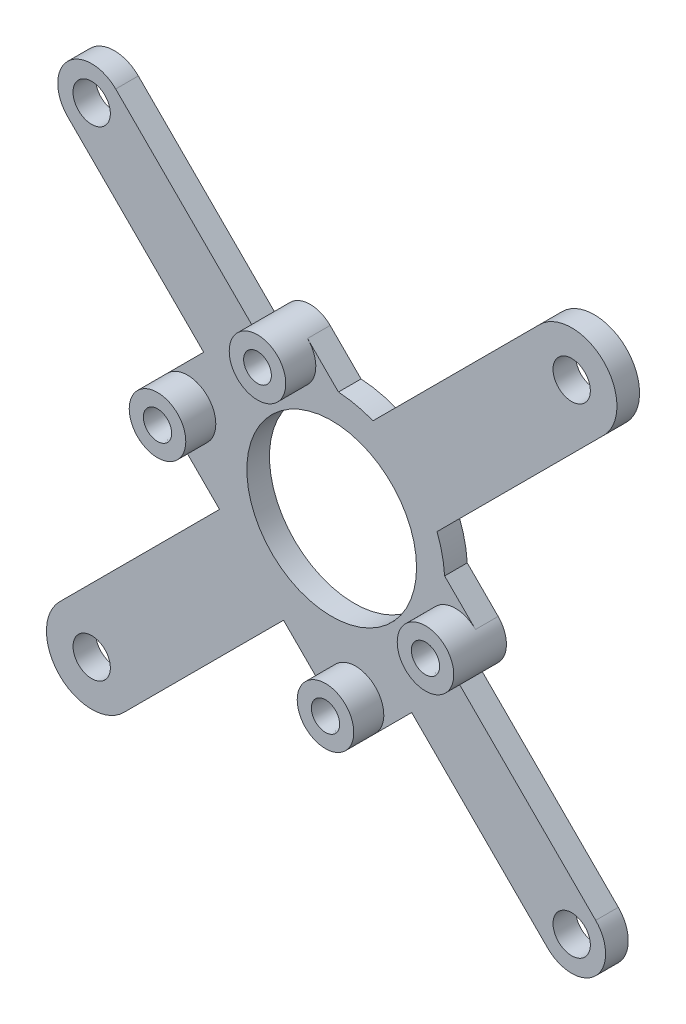
from build123d import *

# Parameters (mm, degrees)
SKETCH1_R           = 1.65
BOSS_EXTRUDE1_DEPTH = 2
SKETCH2_R           = 1.25
BOSS_EXTRUDE2_DEPTH = 2
SKETCH3_R           = 7.5
CUT_EXTRUDE1_DEPTH  = 2
BOSS_EXTRUDE3_START = 2.65408
SKETCH4_R           = 2.5
SKETCH4_R_2         = 1.25
BOSS_EXTRUDE3_DEPTH = 2.65408
SKETCH5_R           = 1.797788616
SKETCH5_R_2         = 1.10000034
SKETCH5_R_3         = 2.012466026
SKETCH5_R_4         = 1.729091626
SKETCH5_R_5         = 1.81324602
SKETCH5_R_6         = 1.075
BOSS_EXTRUDE4_DEPTH = 4.65408
CHAMFER1_SIZE       = 1.714507845
CHAMFER1_SIZE_2     = 0.15


with BuildPart() as part:
    # Sketch1 → Boss-Extrude1 (new body)
    with BuildSketch(Plane.XY):
        with BuildLine():
            Line((24.04163056, 18.384776311), (9.309167823, 3.652313574))
            ThreePointArc((9.309167823, 3.652313574), (9.985739131, -0.533867035), (8.866689125, -4.624048438))
            Line((8.866689125, -4.624048438), (23.334523779, -19.091883092))
            ThreePointArc((23.334523779, -19.091883092), (23.334523779, -23.334523779), (19.091883092, -23.334523779))
            Line((19.091883092, -23.334523779), (4.624048438, -8.866689125))
            ThreePointArc((4.624048438, -8.866689125), (0.533867035, -9.985739131), (-3.652313574, -9.309167823))
            Line((-3.652313574, -9.309167823), (-18.384776311, -24.04163056))
            ThreePointArc((-18.384776311, -24.04163056), (-24.04163056, -24.04163056), (-24.04163056, -18.384776311))
            Line((-24.04163056, -18.384776311), (-9.309167823, -3.652313574))
            ThreePointArc((-9.309167823, -3.652313574), (-9.985739131, 0.533867035), (-8.866689125, 4.624048438))
            Line((-8.866689125, 4.624048438), (-23.334523779, 19.091883092))
            ThreePointArc((-23.334523779, 19.091883092), (-23.334523779, 23.334523779), (-19.091883092, 23.334523779))
            Line((-19.091883092, 23.334523779), (-4.624048438, 8.866689125))
            ThreePointArc((-4.624048438, 8.866689125), (-0.533867035, 9.985739131), (3.652313574, 9.309167823))
            Line((3.652313574, 9.309167823), (18.384776311, 24.04163056))
            ThreePointArc((18.384776311, 24.04163056), (24.04163056, 24.04163056), (24.04163056, 18.384776311))
        make_face()
        with Locations((21.213203436, -21.213203436)):
            Circle(SKETCH1_R, mode=Mode.SUBTRACT)
        with Locations((21.213203436, 21.213203436)):
            Circle(SKETCH1_R, mode=Mode.SUBTRACT)
        with Locations((-21.213203436, 21.213203436)):
            Circle(SKETCH1_R, mode=Mode.SUBTRACT)
        with Locations((-21.213203436, -21.213203436)):
            Circle(SKETCH1_R, mode=Mode.SUBTRACT)
    extrude(amount=BOSS_EXTRUDE1_DEPTH)

    # Sketch2 → Boss-Extrude2 (add)
    with BuildSketch(Plane.XY.offset(2)):
        with BuildLine():
            Line((-2.135460216, 12.713781538), (12.713781227, -2.135459905))
            ThreePointArc((12.713781227, -2.135459905), (13.446014274, -3.903226858), (12.713781227, -5.670993811))
            Line((12.713781227, -5.670993811), (3.874947975, -14.509827063))
            ThreePointArc((3.874947975, -14.509827063), (2.107181022, -15.24206011), (0.339414069, -14.509827063))
            Line((0.339414069, -14.509827063), (-14.509827374, 0.33941438))
            ThreePointArc((-14.509827374, 0.33941438), (-15.242060421, 2.107181333), (-14.509827374, 3.874948286))
            Line((-14.509827374, 3.874948286), (-5.670994122, 12.713781538))
            ThreePointArc((-5.670994122, 12.713781538), (-3.903227169, 13.446014585), (-2.135460216, 12.713781538))
        make_face()
        with Locations((-3.903227169, 10.946014585)):
            Circle(SKETCH2_R, mode=Mode.SUBTRACT)
        with Locations((10.946014274, -3.903226858)):
            Circle(SKETCH2_R, mode=Mode.SUBTRACT)
        with Locations((2.107181022, -12.74206011)):
            Circle(SKETCH2_R, mode=Mode.SUBTRACT)
        with Locations((-12.742060421, 2.107181333)):
            Circle(SKETCH2_R, mode=Mode.SUBTRACT)
    extrude(amount=-BOSS_EXTRUDE2_DEPTH)

    # Sketch3 → Cut-Extrude1 (cut)
    with BuildSketch(Plane.XY.offset(2)):
        Circle(SKETCH3_R)
    extrude(amount=-CUT_EXTRUDE1_DEPTH, mode=Mode.SUBTRACT)

    # Sketch4 → Boss-Extrude3 (add)
    # profile 1 of 4: a face of its own
    with BuildSketch(Plane.XY.offset(2).offset(BOSS_EXTRUDE3_START)):
        with Locations(Location((-3.903227169, 10.946014585, 0), (0, 0, 45))):
            Circle(SKETCH4_R)
        with Locations((-3.903227169, 10.946014585)):
            Circle(SKETCH4_R_2, mode=Mode.SUBTRACT)
    # profile 2 of 4: a face of its own
    with BuildSketch(Plane.XY.offset(2).offset(BOSS_EXTRUDE3_START)):
        with Locations(Location((-12.742060421, 2.107181333, 0), (0, 0, 135))):
            Circle(SKETCH4_R)
        with Locations((-12.742060421, 2.107181333)):
            Circle(SKETCH4_R_2, mode=Mode.SUBTRACT)
    # profile 3 of 4: a face of its own
    with BuildSketch(Plane.XY.offset(2).offset(BOSS_EXTRUDE3_START)):
        with Locations(Location((10.946014274, -3.903226858, 0), (0, 0, 45))):
            Circle(SKETCH4_R)
        with Locations((10.946014274, -3.903226858)):
            Circle(SKETCH4_R_2, mode=Mode.SUBTRACT)
    # profile 4 of 4: a face of its own
    with BuildSketch(Plane.XY.offset(2).offset(BOSS_EXTRUDE3_START)):
        with Locations(Location((2.107181022, -12.74206011, 0), (0, 0, 315))):
            Circle(SKETCH4_R)
        with Locations((2.107181022, -12.74206011)):
            Circle(SKETCH4_R_2, mode=Mode.SUBTRACT)
    extrude(amount=-BOSS_EXTRUDE3_DEPTH)

    # Sketch5 → Boss-Extrude4 (add)
    # profile 1 of 4: a face of its own
    with BuildSketch(Plane.XY.offset(4.65408)):
        with Locations((10.946014274, -3.903226858)):
            Circle(SKETCH5_R)
        with Locations((10.946014274, -3.903226858)):
            Circle(SKETCH5_R_2, mode=Mode.SUBTRACT)
    # profile 2 of 4: a face of its own
    with BuildSketch(Plane.XY.offset(4.65408)):
        with Locations((2.107181022, -12.74206011)):
            Circle(SKETCH5_R_3)
        with Locations((2.107181022, -12.74206011)):
            Circle(SKETCH5_R_2, mode=Mode.SUBTRACT)
    # profile 3 of 4: a face of its own
    with BuildSketch(Plane.XY.offset(4.65408)):
        with Locations((-12.742060421, 2.107181333)):
            Circle(SKETCH5_R_4)
        with Locations((-12.742060421, 2.107181333)):
            Circle(SKETCH5_R_2, mode=Mode.SUBTRACT)
    # profile 4 of 4: a face of its own
    with BuildSketch(Plane.XY.offset(4.65408)):
        with Locations((-3.903227169, 10.946014585)):
            Circle(SKETCH5_R_5)
        with Locations((-3.903227169, 10.946014585)):
            Circle(SKETCH5_R_6, mode=Mode.SUBTRACT)
    extrude(amount=-BOSS_EXTRUDE4_DEPTH)

    # Chamfer1
    # the kernel refuses this chamfer: 1.714507845, 0.15 mm, written as the material it takes off along each edge
    with BuildSketch(Plane(origin=(10.946014274, -3.903226858, 4.65408), x_dir=(1, 0, 0), z_dir=(0, -1, 0))) as chamfer1_piece_1:
        Polygon((1.10000034, -CHAMFER1_SIZE), (1.10000034 + CHAMFER1_SIZE_2, 0), (1.10000034, 0), align=None)
    revolve(axis=Axis((10.946014274, -3.903226858, 4.65408), (0, 0, 1)), mode=Mode.SUBTRACT)
    with BuildSketch(Plane(origin=(2.107181022, -12.74206011, 4.65408), x_dir=(1, 0, 0), z_dir=(0, -1, 0))) as chamfer1_piece_2:
        Polygon((1.10000034, -CHAMFER1_SIZE), (1.10000034 + CHAMFER1_SIZE_2, 0), (1.10000034, 0), align=None)
    revolve(axis=Axis((2.107181022, -12.74206011, 4.65408), (0, 0, 1)), mode=Mode.SUBTRACT)
    with BuildSketch(Plane(origin=(-12.742060421, 2.107181333, 4.65408), x_dir=(1, 0, 0), z_dir=(0, -1, 0))) as chamfer1_piece_3:
        Polygon((1.10000034, -CHAMFER1_SIZE), (1.10000034 + CHAMFER1_SIZE_2, 0), (1.10000034, 0), align=None)
    revolve(axis=Axis((-12.742060421, 2.107181333, 4.65408), (0, 0, 1)), mode=Mode.SUBTRACT)
    with BuildSketch(Plane(origin=(-3.903227169, 10.946014585, 4.65408), x_dir=(1, 0, 0), z_dir=(0, -1, 0))) as chamfer1_piece_4:
        Polygon((1.075, -CHAMFER1_SIZE), (1.075 + CHAMFER1_SIZE_2, 0), (1.075, 0), align=None)
    revolve(axis=Axis((-3.903227169, 10.946014585, 4.65408), (0, 0, 1)), mode=Mode.SUBTRACT)


solid = part.part
